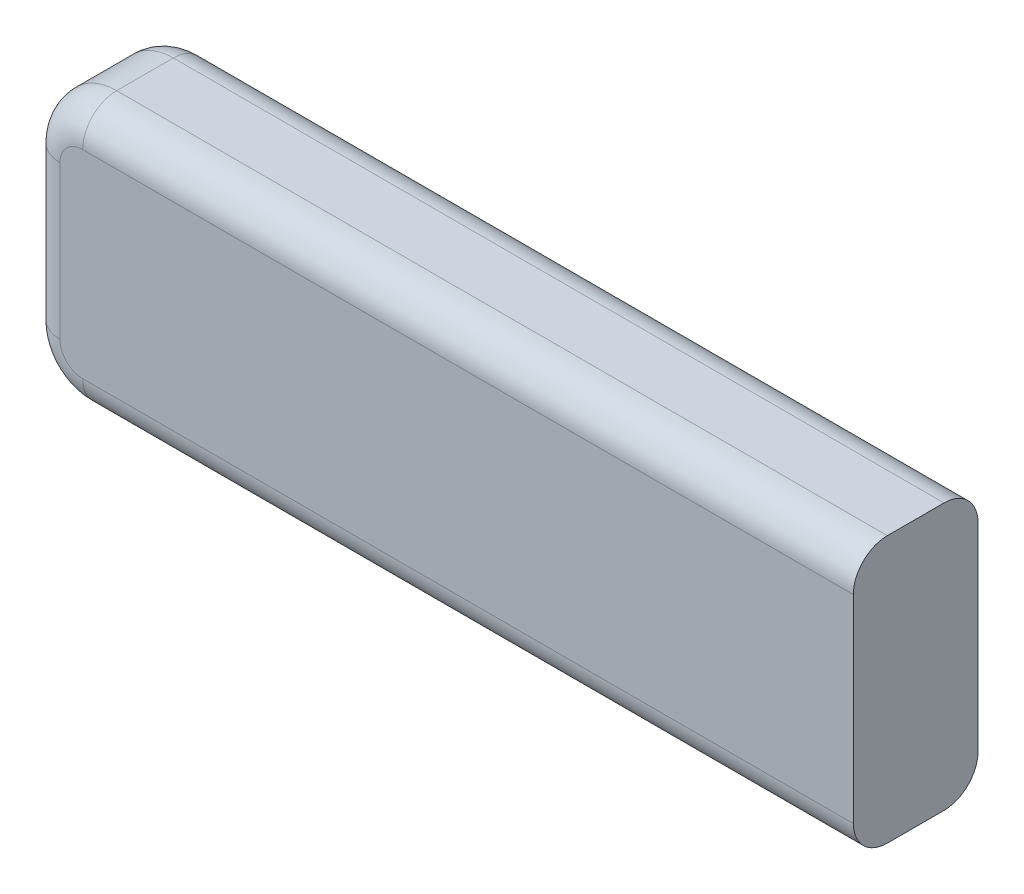
from build123d import *

# Parameters (mm, degrees)
SKETCH1_W           = 36.5
SKETCH1_H           = 11.75
BOSS_EXTRUDE1_DEPTH = 5.5
BODY_FILLET_R       = 1.5
FILLET1_R           = 2.5


with BuildPart() as part:
    # Sketch1 → Boss-Extrude1 (new body)
    with BuildSketch(Plane.XY):
        with Locations((18.25, 5.875)):
            Rectangle(SKETCH1_W, SKETCH1_H)
    extrude(amount=BOSS_EXTRUDE1_DEPTH)

    # Body Fillet
    body_fillet_edges = [part.edges().sort_by_distance(p)[0] for p in [
        (18.25, 11.75, 5.5),
        (0, 5.875, 5.5),
        (18.25, 11.75, 0),
        (18.25, 0, 0),
        (0, 5.875, 0),
        (18.25, 0, 5.5),
    ]]
    fillet(body_fillet_edges, radius=BODY_FILLET_R)

    # Fillet1
    # the kernel refuses this fillet: 2.5 mm, written as the material it takes off along each edge
    with BuildSketch(Plane(origin=(2.5, 9.25, 0), x_dir=(-1, 0, 0), z_dir=(0, -1, 0))) as fillet1_piece_1:
        with BuildLine():
            CenterArc((1, -1.5), 1.5, 0, 90)
            Line((2.5, -1.5), (2.5, 0))
            Line((2.5, 0), (1, 0))
        make_face()
    revolve(axis=Axis((2.5, 9.25, 0), (0, 0, -1)), revolution_arc=90, mode=Mode.SUBTRACT)
    with BuildSketch(Plane(origin=(2.5, 2.5, 0), x_dir=(0, -1, 0), z_dir=(1, 0, 0))) as fillet1_piece_2:
        with BuildLine():
            CenterArc((1, -1.5), 1.5, 0, 90)
            Line((2.5, -1.5), (2.5, 0))
            Line((2.5, 0), (1, 0))
        make_face()
    revolve(axis=Axis((2.5, 2.5, 0), (0, 0, -1)), revolution_arc=90, mode=Mode.SUBTRACT)
    with BuildSketch(Plane(origin=(2.5, 9.25, 5.5), x_dir=(0, 1, 0), z_dir=(1, 0, 0))) as fillet1_piece_3:
        with BuildLine():
            CenterArc((1, -1.5), 1.5, 0, 90)
            Line((2.5, -1.5), (2.5, 0))
            Line((2.5, 0), (1, 0))
        make_face()
    revolve(axis=Axis((2.5, 9.25, 5.5), (0, 0, 1)), revolution_arc=90, mode=Mode.SUBTRACT)
    with BuildSketch(Plane(origin=(2.5, 2.5, 5.5), x_dir=(-1, 0, 0), z_dir=(0, 1, 0))) as fillet1_piece_4:
        with BuildLine():
            CenterArc((1, -1.5), 1.5, 0, 90)
            Line((2.5, -1.5), (2.5, 0))
            Line((2.5, 0), (1, 0))
        make_face()
    revolve(axis=Axis((2.5, 2.5, 5.5), (0, 0, 1)), revolution_arc=90, mode=Mode.SUBTRACT)
    with BuildSketch(Plane(origin=(0, 0, 0), x_dir=(1, 0, 0), z_dir=(0, 0, 1)), Plane(origin=(0, 11.75, 0), x_dir=(0, -1, 0), z_dir=(0, 0, 1))) as fillet1_piece_5:
        with BuildLine():
            CenterArc((FILLET1_R, FILLET1_R), FILLET1_R, 180, 90)
            Line((0, FILLET1_R), (0, 0))
            Line((0, 0), (FILLET1_R, 0))
        make_face()
    extrude(amount=5.5, mode=Mode.SUBTRACT)


solid = part.part
